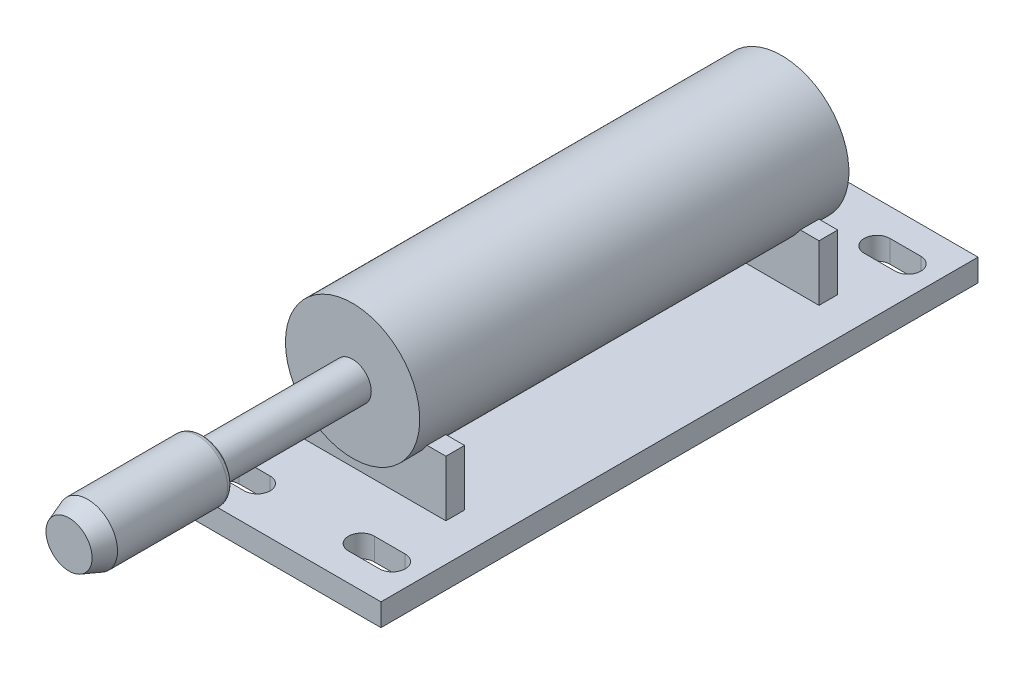
from build123d import *

# Parameters (mm, degrees)
SKETCH1_W                = 60.2
SKETCH1_H                = 160
BOSS_EXTRUDE1_DEPTH      = 6
SKETCH3_W                = 40
SKETCH3_H                = 5
BOSS_EXTRUDE2_DEPTH      = 15
BOSS_EXTRUDE3_DEPTH      = 5
BOSS_EXTRUDE3_DEPTH_BACK = 110
SKETCH4_R                = 18
SKETCH5_R                = 5
BOSS_EXTRUDE4_DEPTH      = 40
SKETCH6_R                = 8
BOSS_EXTRUDE5_DEPTH      = 36
CHAMFER1_SIZE            = 5
CHAMFER1_SIZE2           = 1.819851171
FILLET1_R                = 1.5


with BuildPart() as part:
    # Sketch1 → Boss-Extrude1 (new body)
    with BuildSketch(Plane(origin=(0, 0, 0), x_dir=(1, 0, 0), z_dir=(0, 1, 0))):
        with Locations((30.1, 80)):
            Rectangle(SKETCH1_W, SKETCH1_H)
        with BuildLine():
            Line((7.85, 152.55), (16.15, 152.55))
            ThreePointArc((16.15, 152.55), (19.6, 149.1), (16.15, 145.65))
            Line((16.15, 145.65), (7.85, 145.65))
            ThreePointArc((7.85, 145.65), (4.4, 149.1), (7.85, 152.55))
        make_face(mode=Mode.SUBTRACT)
        with BuildLine():
            Line((52.35, 145.65), (44.05, 145.65))
            ThreePointArc((44.05, 145.65), (40.6, 149.1), (44.05, 152.55))
            Line((44.05, 152.55), (52.35, 152.55))
            ThreePointArc((52.35, 152.55), (55.8, 149.1), (52.35, 145.65))
        make_face(mode=Mode.SUBTRACT)
        with BuildLine():
            Line((52.35, 7.45), (44.05, 7.45))
            ThreePointArc((44.05, 7.45), (40.6, 10.9), (44.05, 14.35))
            Line((44.05, 14.35), (52.35, 14.35))
            ThreePointArc((52.35, 14.35), (55.8, 10.9), (52.35, 7.45))
        make_face(mode=Mode.SUBTRACT)
        with BuildLine():
            Line((7.85, 14.35), (16.15, 14.35))
            ThreePointArc((16.15, 14.35), (19.6, 10.9), (16.15, 7.45))
            Line((16.15, 7.45), (7.85, 7.45))
            ThreePointArc((7.85, 7.45), (4.4, 10.9), (7.85, 14.35))
        make_face(mode=Mode.SUBTRACT)
    extrude(amount=BOSS_EXTRUDE1_DEPTH)

    # Sketch3 → Boss-Extrude2 (add)
    with BuildSketch(Plane(origin=(0, 6, 0), x_dir=(1, 0, 0), z_dir=(0, 1, 0))):
        with Locations((30.1, 130)):
            Rectangle(SKETCH3_W, SKETCH3_H)
        with Locations((30.1, 30)):
            Rectangle(SKETCH3_W, SKETCH3_H)
    extrude(amount=BOSS_EXTRUDE2_DEPTH)

    # Sketch4 → Boss-Extrude3 (add, two sides: drawn at the far end of the back side and taken through both)
    with BuildSketch(Plane(origin=(0, 0, -132.5), x_dir=(-1, 0, 0), z_dir=(0, 0, -1)).offset(-BOSS_EXTRUDE3_DEPTH_BACK)):
        with Locations((-30.1, 31)):
            Circle(SKETCH4_R)
    extrude(amount=BOSS_EXTRUDE3_DEPTH + BOSS_EXTRUDE3_DEPTH_BACK)

    # Sketch5 → Boss-Extrude4 (add)
    with BuildSketch(Plane.XY.offset(-22.5)):
        with Locations((30.1, 31)):
            Circle(SKETCH5_R)
    extrude(amount=BOSS_EXTRUDE4_DEPTH)

    # Sketch6 → Boss-Extrude5 (add)
    with BuildSketch(Plane.XY.offset(17.5)):
        with Locations((30.1, 31)):
            Circle(SKETCH6_R)
    extrude(amount=BOSS_EXTRUDE5_DEPTH)

    # Chamfer1
    chamfer1_edges = [part.edges().sort_by_distance(p)[0] for p in [
        (22.1, 31, 53.5),
    ]]
    chamfer1_side = [part.faces().sort_by_distance(p)[0] for p in [
        (22.1, 31, 35.5),
    ]]
    chamfer(chamfer1_edges, length=CHAMFER1_SIZE, length2=CHAMFER1_SIZE2, reference=chamfer1_side[0])

    # Fillet1
    fillet1_edges = [part.edges().sort_by_distance(p)[0] for p in [
        (25.1, 31, 17.5),
        (22.1, 31, 17.5),
    ]]
    fillet(fillet1_edges, radius=FILLET1_R - 0.0001)  # a hair under: the kernel refuses the full size


solid = part.part
